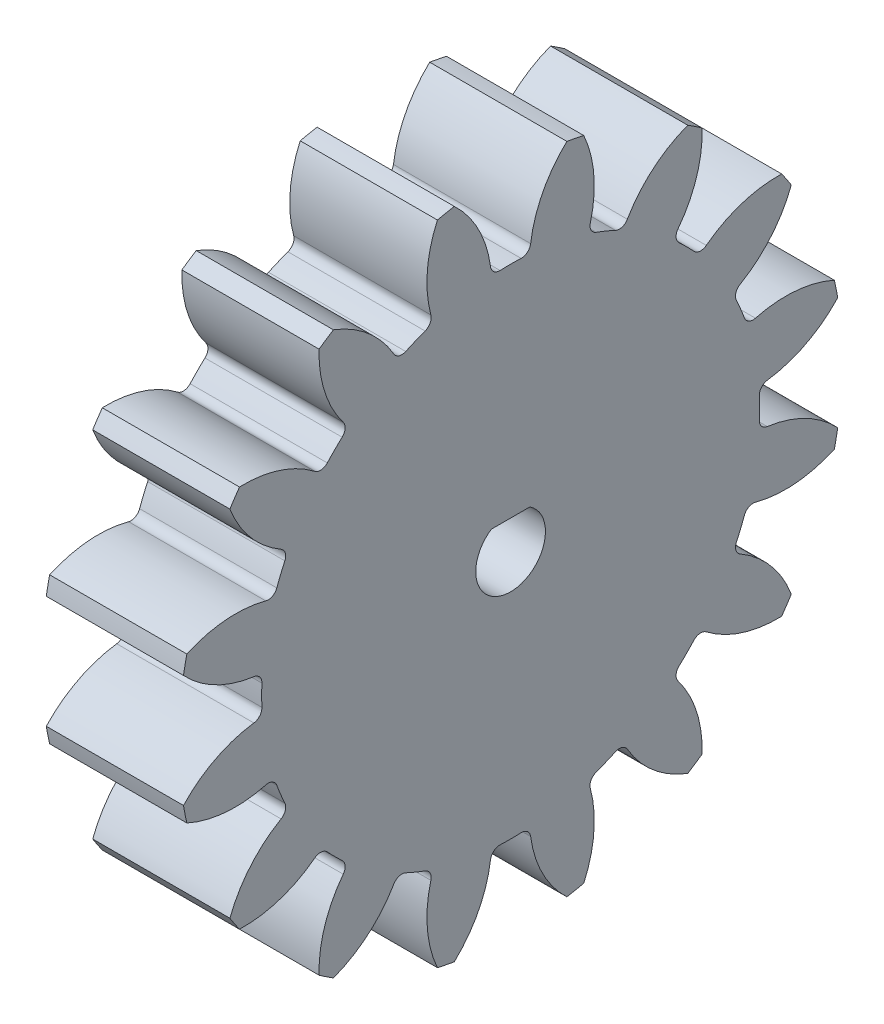
from build123d import *

# Parameters (mm, degrees)
BASPROSKE_W                = 11.811
BASPROSKE_H                = 28.575
TOOTHCUT_DEPTH             = 43.101792967
ROOTFILLETS_R              = 0.79502
TEETHCUTS_COUNT            = 16
TEETHCUTS_ANGLE            = 337.5
ROOTFILLETS_OF_TEETHCUTS_R = 0.79502
BORSKE_R                   = 0.396875
BORE_DEPTH                 = 50.8000508
CUT_EXTRUDE1_DEPTH         = 42.540449667


with BuildPart() as part:
    # BasProSke → Base-Revolve (revolve)
    with BuildSketch(Plane(origin=(0, 0, 0), x_dir=(1, 0, 0), z_dir=(0, 1, 0))):
        with Locations((5.9055, 14.2875)):
            Rectangle(BASPROSKE_W, BASPROSKE_H)
    revolve(axis=Axis((-10, 0, 0), (1, 0, 0)))

    # TooCutSke → ToothCut (cut, through all)
    with BuildSketch(Plane(origin=(0, 0, 0), x_dir=(0, 0, -1), z_dir=(1, 0, 0))):
        with BuildLine():
            ThreePointArc((1.653773222, 21.366073035), (0, 21.42998), (-1.653773222, 21.366073035))
            ThreePointArc((-1.653773222, 21.366073035), (-2.605634946, 25.083646688), (-4.868483936, 28.182986789))
            ThreePointArc((-4.868483936, 28.182986789), (0, 28.6004), (4.868483936, 28.182986789))
            ThreePointArc((4.868483936, 28.182986789), (2.605634946, 25.083646688), (1.653773222, 21.366073035))
        make_face()
    toothcut = extrude(amount=TOOTHCUT_DEPTH, mode=Mode.SUBTRACT)

    # RootFillets
    rootfillets_edges = [part.edges().sort_by_distance(p)[0] for p in [
        (5.9055, 21.366073035, -1.653773222),
        (5.9055, 21.366073035, 1.653773222),
    ]]
    fillet(rootfillets_edges, radius=ROOTFILLETS_R)

    # TeethCuts: ToothCut ×16 about axis
    teethcuts_axis = Axis((-10, 0, 0), (1, 0, 0))
    for i in range(1, TEETHCUTS_COUNT):
        add(toothcut.rotate(teethcuts_axis, i * TEETHCUTS_ANGLE / (TEETHCUTS_COUNT - 1)), mode=Mode.SUBTRACT)

    # RootFillets of TeethCuts
    rootfillets_of_teethcuts_edges = [part.edges().sort_by_distance(p)[0] for p in [
        (5.9055, 20.37254918, 6.648554933),
        (5.9055, 19.106805954, 9.704329397),
        (5.9055, 16.27748939, 13.93870087),
        (5.9055, 13.93870087, 16.27748939),
        (5.9055, 9.704329397, 19.106805954),
        (5.9055, 6.648554933, 20.37254918),
        (5.9055, 1.653773222, 21.366073035),
        (5.9055, -1.653773222, 21.366073035),
        (5.9055, -6.648554933, 20.37254918),
        (5.9055, -9.704329397, 19.106805954),
        (5.9055, -13.93870087, 16.27748939),
        (5.9055, -16.27748939, 13.93870087),
        (5.9055, -19.106805954, 9.704329397),
        (5.9055, -20.37254918, 6.648554933),
        (5.9055, -21.366073035, 1.653773222),
        (5.9055, -21.366073035, -1.653773222),
        (5.9055, -20.37254918, -6.648554933),
        (5.9055, -19.106805954, -9.704329397),
        (5.9055, -16.27748939, -13.93870087),
        (5.9055, -13.93870087, -16.27748939),
        (5.9055, -9.704329397, -19.106805954),
        (5.9055, -6.648554933, -20.37254918),
        (5.9055, -1.653773222, -21.366073035),
        (5.9055, 1.653773222, -21.366073035),
        (5.9055, 6.648554933, -20.37254918),
        (5.9055, 9.704329397, -19.106805954),
        (5.9055, 13.93870087, -16.27748939),
        (5.9055, 16.27748939, -13.93870087),
        (5.9055, 19.106805954, -9.704329397),
        (5.9055, 20.37254918, -6.648554933),
    ]]
    fillet(rootfillets_of_teethcuts_edges, radius=ROOTFILLETS_OF_TEETHCUTS_R)

    # BorSke → Bore (cut, symmetric)
    with BuildSketch(Plane(origin=(0, 0, 0), x_dir=(0, 0, -1), z_dir=(1, 0, 0))):
        Circle(BORSKE_R)
    extrude(amount=BORE_DEPTH, both=True, mode=Mode.SUBTRACT)

    # Sketch1 → Cut-Extrude1 (cut, through all)
    with BuildSketch(Plane(origin=(11.811, 0, 0), x_dir=(0, 0, -1), z_dir=(1, 0, 0))):
        with BuildLine():
            Line((-1.658312395, 2.5), (1.658312395, 2.5))
            ThreePointArc((1.658312395, 2.5), (0, -3), (-1.658312395, 2.5))
        make_face()
    extrude(amount=-CUT_EXTRUDE1_DEPTH, mode=Mode.SUBTRACT)


solid = part.part
